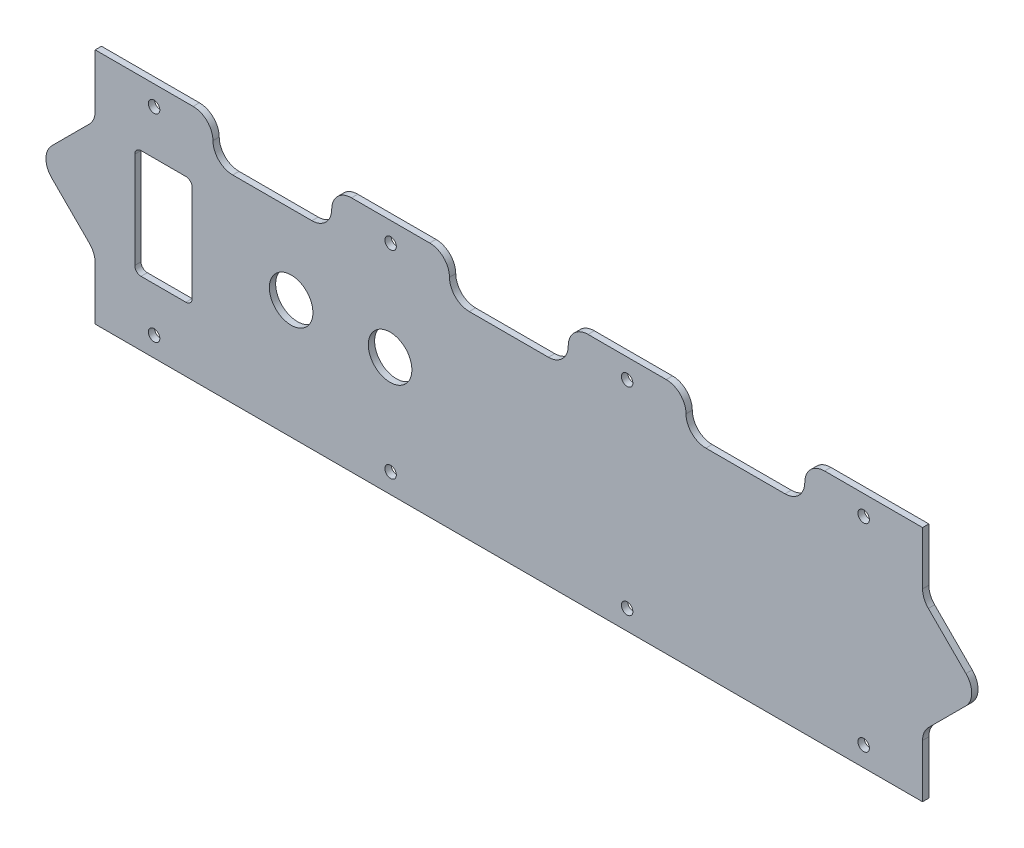
from build123d import *

# Parameters (mm, degrees)
SKETCH2_W            = 540
SKETCH2_H            = 120
BOSS_EXTRUDE1_DEPTH  = 3.175
SKETCH3_W            = 60
SKETCH3_H            = 20
CUT_EXTRUDE1_DEPTH   = 554.181779007
FILLET1_R            = 10
FILLET2_R            = 10
M5_CLEARANCE_HOLE1_D = 5.8
LPATTERN1_COUNT      = 4
LPATTERN1_PITCH      = 119.5
SKETCH6_R            = 11
SKETCH6_W            = 29
SKETCH6_H            = 55
CUT_EXTRUDE2_DEPTH   = 518.960257277
FILLET3_R            = 3.175


with BuildPart() as part:
    # Sketch2 → Boss-Extrude1 (new body)
    with BuildSketch(Plane.XY):
        with Locations((270, 60)):
            Rectangle(SKETCH2_W, SKETCH2_H)
    extrude(amount=BOSS_EXTRUDE1_DEPTH)

    # Sketch3 → Cut-Extrude1 (cut, through all)
    with BuildSketch(Plane.XY.offset(3.175)):
        with BuildLine():
            Line((0, 0), (61, 0))
            Line((61, 0), (61, 31))
            Line((61, 31), (39.071067812, 52.928932188))
            ThreePointArc((39.071067812, 52.928932188), (36.142135624, 60), (39.071067812, 67.071067812))
            Line((39.071067812, 67.071067812), (61, 89))
            Line((61, 89), (61, 120))
            Line((61, 120), (0, 120))
            Line((0, 120), (0, 0))
        make_face()
        with BuildLine():
            Line((479, 89), (479, 120))
            Line((479, 120), (540, 120))
            Line((540, 120), (540, 0))
            Line((540, 0), (479, 0))
            Line((479, 0), (479, 31))
            Line((479, 31), (500.928932188, 52.928932188))
            ThreePointArc((500.928932188, 52.928932188), (503.857864376, 60), (500.928932188, 67.071067812))
            Line((500.928932188, 67.071067812), (479, 89))
        make_face()
        with Locations((270, 110)):
            Rectangle(SKETCH3_W, SKETCH3_H)
        with Locations((150.5, 110)):
            Rectangle(SKETCH3_W, SKETCH3_H)
        with Locations((389.5, 110)):
            Rectangle(SKETCH3_W, SKETCH3_H)
    extrude(amount=-CUT_EXTRUDE1_DEPTH, mode=Mode.SUBTRACT)

    # Fillet1
    fillet1_edges = [part.edges().sort_by_distance(p)[0] for p in [
        (61, 89, 1.5875),
        (61, 31, 1.5875),
        (479, 31, 1.5875),
        (479, 89, 1.5875),
    ]]
    fillet(fillet1_edges, radius=FILLET1_R)

    # Fillet2
    fillet2_edges = [part.edges().sort_by_distance(p)[0] for p in [
        (419.5, 100, 1.5875),
        (359.5, 100, 1.5875),
        (300, 100, 1.5875),
        (240, 100, 1.5875),
        (180.5, 100, 1.5875),
        (120.5, 100, 1.5875),
    ]]
    fillet(fillet2_edges, radius=FILLET2_R)
    fillet2_2_edges = [part.edges().sort_by_distance(p)[0] for p in [
        (419.5, 120, 1.5875),
        (359.5, 120, 1.5875),
        (300, 120, 1.5875),
        (240, 120, 1.5875),
        (180.5, 120, 1.5875),
        (120.5, 120, 1.5875),
    ]]
    fillet(fillet2_2_edges, radius=FILLET2_R - 0.0001)  # a hair under: the kernel refuses the full size

    # M5 Clearance Hole1 (through all)
    with Locations(Plane(origin=(90.75, 10, 3.175), x_dir=(1, 0, 0), z_dir=(0, 0, 1))):
        with Locations((0, 0), (0, 100)):
            m5_clearance_hole1 = Hole(M5_CLEARANCE_HOLE1_D / 2)

    # LPattern1: M5 Clearance Hole1 ×4
    with Locations(*[(i * LPATTERN1_PITCH, 0, 0) for i in range(1, LPATTERN1_COUNT)]):
        add(m5_clearance_hole1, mode=Mode.SUBTRACT)

    # Sketch6 → Cut-Extrude2 (cut, through all)
    with BuildSketch(Plane.XY.offset(3.175)):
        with Locations((160, 60)):
            Circle(SKETCH6_R)
        with Locations((210, 60)):
            Circle(SKETCH6_R)
        with Locations((95.5, 60)):
            Rectangle(SKETCH6_W, SKETCH6_H)
    extrude(amount=-CUT_EXTRUDE2_DEPTH, mode=Mode.SUBTRACT)

    # Fillet3
    fillet3_edges = [part.edges().sort_by_distance(p)[0] for p in [
        (81, 32.5, 1.5875),
        (81, 87.5, 1.5875),
        (110, 87.5, 1.5875),
        (110, 32.5, 1.5875),
    ]]
    fillet(fillet3_edges, radius=FILLET3_R)


solid = part.part
